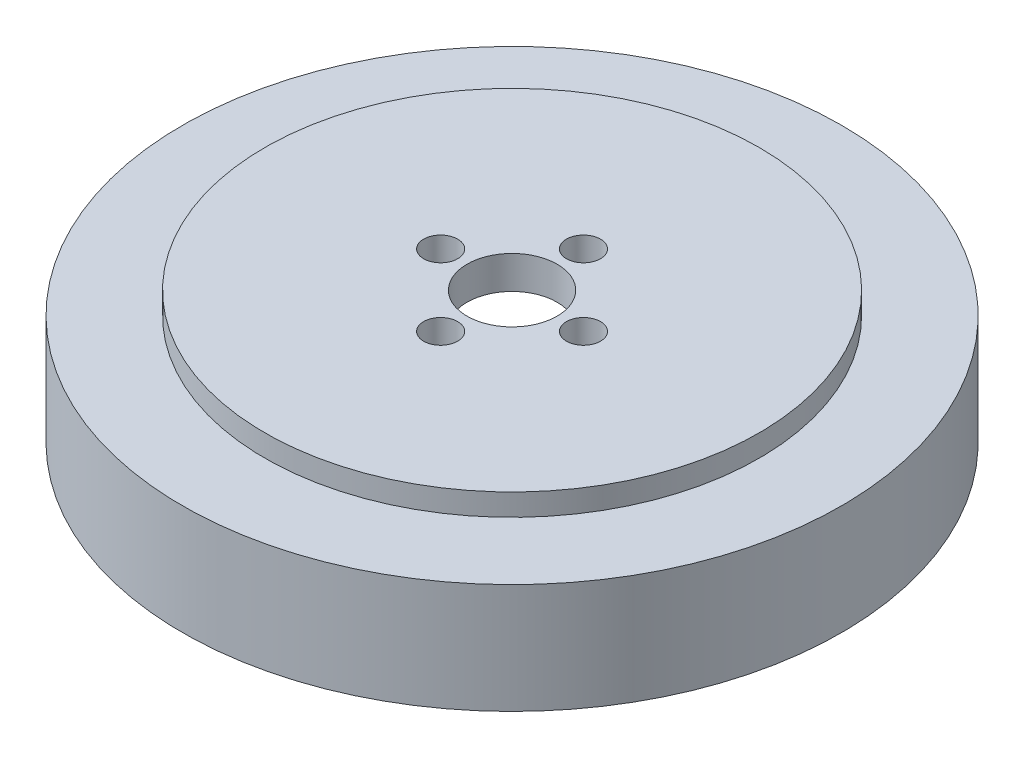
from build123d import *

# Parameters (mm, degrees)
SKETCH_2_W          = 7.5
SKETCH_2_H          = 10
SKETCH_3_R          = 1.55
CUT_EXTRUDE_1_DEPTH = 10


with BuildPart() as part:
    # 草图1 → 旋转1 (revolve)
    with BuildSketch(Plane.XY):
        Polygon((4.1, 0), (4.1, 3), (22.5, 3), (22.5, -10), (21, -10), (21, 0), align=None)
    revolve(axis=Axis((0, 0, 0), (0, 1, 0)))

    # 草图3 → 切除-拉伸1 (cut)
    with BuildSketch(Plane.XZ):
        with Locations((6.5, 0)):
            Circle(SKETCH_3_R)
        with Locations((-6.5, 0)):
            Circle(SKETCH_3_R)
        with Locations((0, 6.5)):
            Circle(SKETCH_3_R)
        with Locations((0, -6.5)):
            Circle(SKETCH_3_R)
    extrude(amount=-CUT_EXTRUDE_1_DEPTH, mode=Mode.SUBTRACT)


with BuildPart() as body_2:
    # 草图2 → 旋转2 (revolve)
    with BuildSketch(Plane.XY):
        with Locations((26.25, -4)):
            Rectangle(SKETCH_2_W, SKETCH_2_H)
    revolve(axis=Axis((0, 0, 0), (0, 1, 0)))


solid = Compound([part.part, body_2.part])
